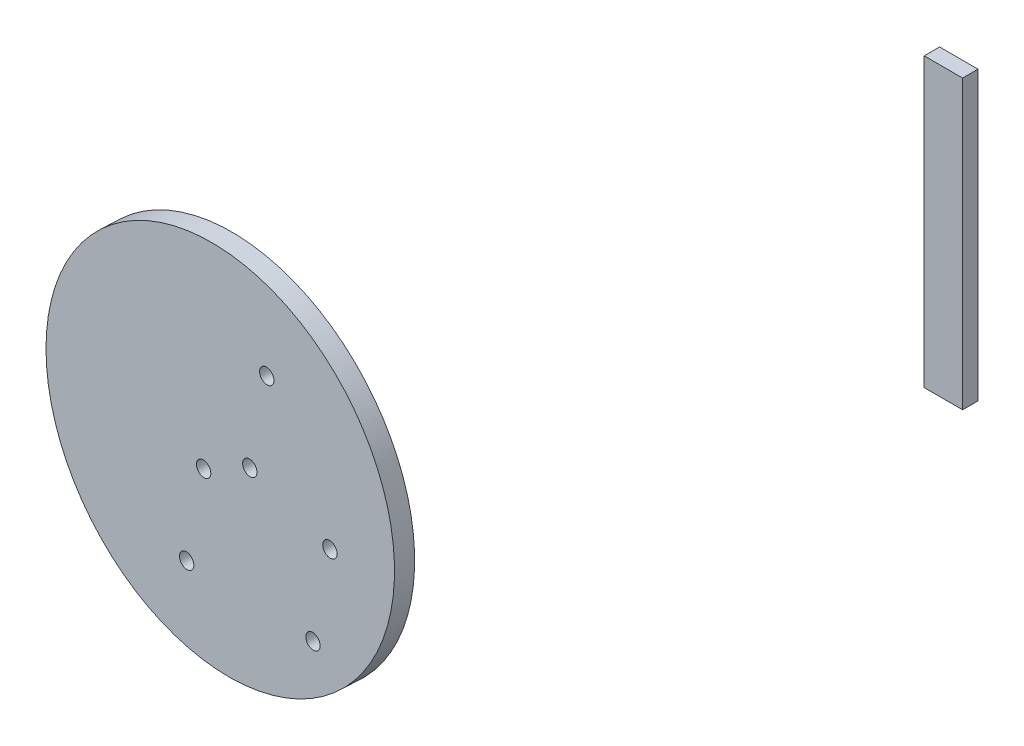
from build123d import *

# Parameters (mm, degrees)
SKETCH1_W           = 6.35
SKETCH1_H           = 47.498
BOSS_EXTRUDE1_DEPTH = 2.54
BOSS_EXTRUDE3_START = 3.175
SKETCH2_R           = 30.350863998
SKETCH2_R_2         = 1.25
BOSS_EXTRUDE3_DEPTH = 3.175


with BuildPart() as part:
    # Sketch1 → Boss-Extrude1 (new body)
    with BuildSketch(Plane.XY.offset(-161.319885359)):
        with Locations((59.772582981, -17.792341484)):
            Rectangle(SKETCH1_W, SKETCH1_H)
    extrude(amount=BOSS_EXTRUDE1_DEPTH)


with BuildPart() as body_2:
    # Sketch2 → Boss-Extrude3 (new body)
    with BuildSketch(Plane(origin=(3.441683615, 0, -69.133783394), x_dir=(-0.9987631275635948, 0, -0.049721373868654335), z_dir=(0.049721373868654335, 0, -0.9987631275635948)).offset(BOSS_EXTRUDE3_START)):
        with Locations((-24.349581368, -22.348909485)):
            Circle(SKETCH2_R)
        with Locations((-40.497009811, -39.877480799)):
            Circle(SKETCH2_R_2, mode=Mode.SUBTRACT)
        with Locations((-43.450883348, -25.17120217)):
            Circle(SKETCH2_R_2, mode=Mode.SUBTRACT)
        with Locations((-18.499964555, -39.877480799)):
            Circle(SKETCH2_R_2, mode=Mode.SUBTRACT)
        with Locations((-32.45236072, -6.12120217)):
            Circle(SKETCH2_R_2, mode=Mode.SUBTRACT)
        with Locations((-21.453838092, -25.17120217)):
            Circle(SKETCH2_R_2, mode=Mode.SUBTRACT)
        with Locations((-29.498487183, -20.827480799)):
            Circle(SKETCH2_R_2, mode=Mode.SUBTRACT)
    extrude(amount=BOSS_EXTRUDE3_DEPTH)


solid = Compound([part.part, body_2.part])
